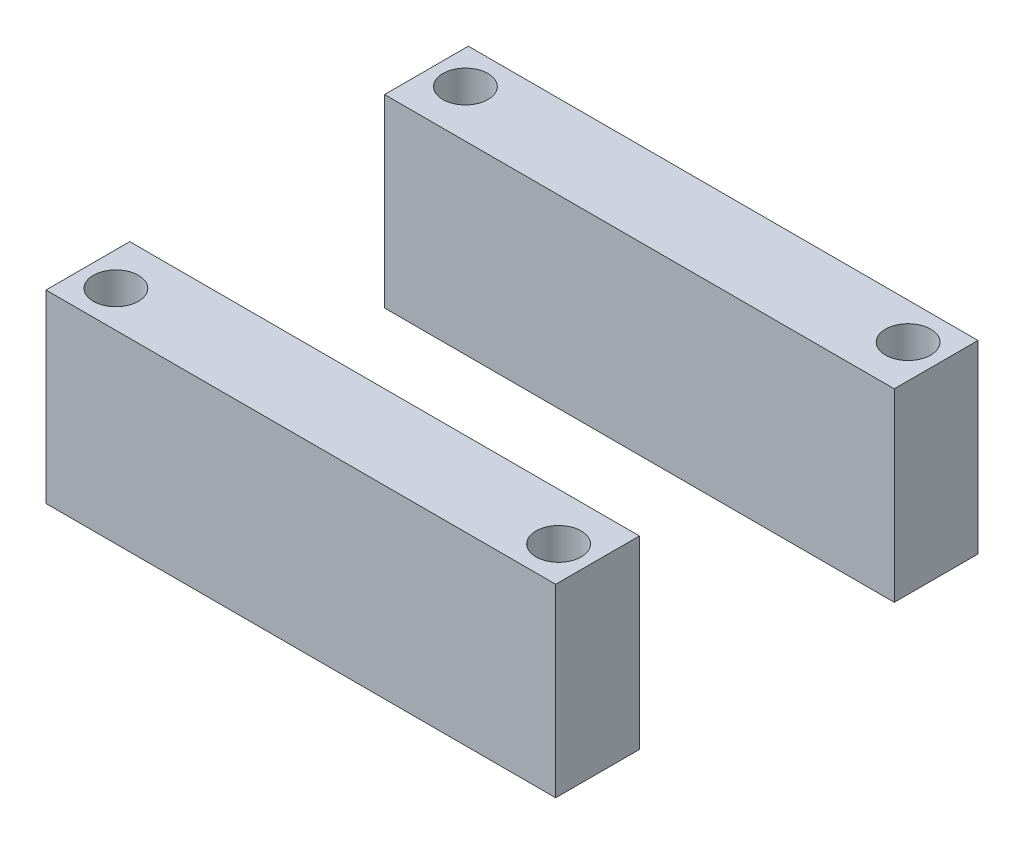
from build123d import *

# Parameters (mm, degrees)
SKETCH1_W           = 35
SKETCH1_H           = 29
SKETCH1_R           = 1.55
BOSS_EXTRUDE1_DEPTH = 12.7
SKETCH2_W           = 35
SKETCH2_H           = 17.5
CUT_EXTRUDE1_DEPTH  = 27.03440032


with BuildPart() as part:
    # Sketch1 → Boss-Extrude1 (new body)
    with BuildSketch(Plane(origin=(0, 0, 0), x_dir=(1, 0, 0), z_dir=(0, 1, 0))):
        Rectangle(SKETCH1_W, SKETCH1_H)
        with Locations((-15.2, 12)):
            Circle(SKETCH1_R, mode=Mode.SUBTRACT)
        with Locations((15.2, 12)):
            Circle(SKETCH1_R, mode=Mode.SUBTRACT)
        with Locations((-15.2, -12)):
            Circle(SKETCH1_R, mode=Mode.SUBTRACT)
        with Locations((15.2, -12)):
            Circle(SKETCH1_R, mode=Mode.SUBTRACT)
    extrude(amount=BOSS_EXTRUDE1_DEPTH)

    # Sketch2 → Cut-Extrude1 (cut, through all)
    with BuildSketch(Plane(origin=(0, 12.7, 0), x_dir=(1, 0, 0), z_dir=(0, 1, 0))):
        Rectangle(SKETCH2_W, SKETCH2_H)
    extrude(amount=-CUT_EXTRUDE1_DEPTH, mode=Mode.SUBTRACT)


with BuildPart() as cut_extrude1_piece_1:
    # of the separate pieces the step leaves, piece 1, a body of its own (cut_extrude1_pieces)
    add(part.part.solids().sort_by_distance((-17.5, 0, -14.5))[0])


with BuildPart() as cut_extrude1_piece_2:
    # of the separate pieces the step leaves, piece 2, a body of its own (cut_extrude1_pieces)
    add(part.part.solids().sort_by_distance((-17.5, 0, 14.5))[0])


solid = Compound([cut_extrude1_piece_1.part, cut_extrude1_piece_2.part])
